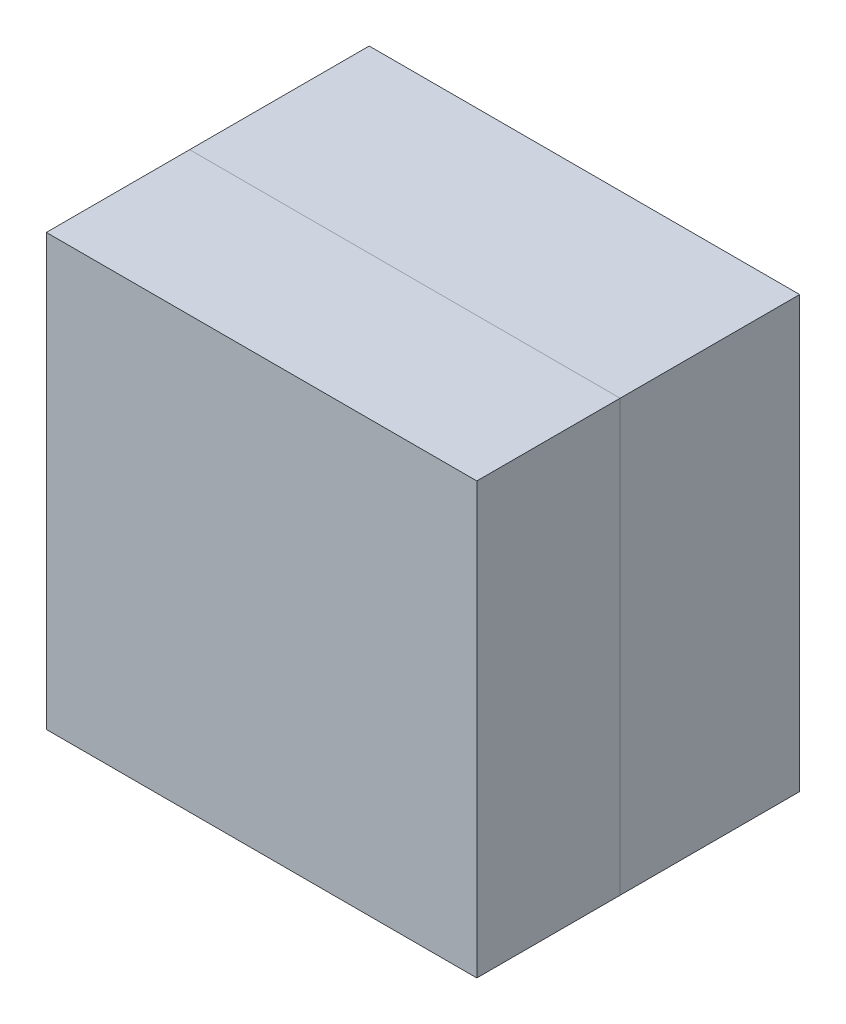
from build123d import *

# Parameters (mm, degrees)
SKETCH1_W           = 304.8
SKETCH1_H           = 304.8
BOSS_EXTRUDE1_DEPTH = 228.6
CAVITY1_OUTLINE_W   = 8.026725253
CAVITY1_OUTLINE_H   = 98.099701296
CAVITY1_OUTLINE_W_2 = 91.798775
CAVITY1_OUTLINE_W_3 = 26.476952247
CAVITY1_OUTLINE_H_2 = 10.562936239
CAVITY1_OUTLINE_H_3 = 12
CAVITY1_OUTLINE_W_4 = 0.3800475
CAVITY1_OUTLINE_W_5 = 11.74498794


# Read off the part's stored shape, not the designer's step: Cavity1
with BuildPart() as part:
    # Sketch1 → Boss-Extrude1 (new body)
    with BuildSketch(Plane.XY):
        Rectangle(SKETCH1_W, SKETCH1_H)
    extrude(amount=BOSS_EXTRUDE1_DEPTH)

    # Cavity1 outline → Cavity1 (revolve, cut)
    with BuildSketch(Plane(origin=(0.908695262, -0.077612753, 0), x_dir=(1, 0, 0), z_dir=(0, -1, 0))):
        Polygon((91.798775, 125.348106713), (91.798775, 127.13294337), (91.186, 127.13294337), (0, 127.13294337), (0, 125.348106713), align=None)
        with BuildLine():
            add(Edge.make_bspline(
                [(91.798775, 127.13294337), (94.605850649, 127.13294337), (97.322433085, 126.518818237), (99.825500253, 125.348106713)],
                knots=[0, 0, 0, 0, 1, 1, 1, 1], degree=3, weights=[0.254333095, 0.254333095, 0.258499794, 0.266833191]))
            Line((91.798775, 127.13294337), (91.798775, 125.348106713))
            Line((91.798775, 125.348106713), (99.825500253, 125.348106713))
        make_face()
        with Locations((95.812137627, 76.298256065)):
            Rectangle(CAVITY1_OUTLINE_W, CAVITY1_OUTLINE_H)
        with BuildLine():
            Line((119.056955539, 116.353347558), (99.825500253, 125.348106713))
            Line((99.825500253, 125.348106713), (99.825500253, 27.248405417))
            Line((99.825500253, 27.248405417), (126.3024525, 27.248405417))
            Line((126.3024525, 27.248405417), (126.3024525, 40.002766714))
            ThreePointArc((126.3024525, 40.002766714), (126.296002424, 40.674677198), (126.276654574, 41.346340032))
            Line((126.276654574, 41.346340032), (123.66176318, 109.413887071))
            ThreePointArc((123.66176318, 109.413887071), (122.333578486, 113.530078475), (119.056955539, 116.353347558))
        make_face()
        with BuildLine():
            Line((0, 127.13294337), (91.186, 127.13294337))
            ThreePointArc((91.186, 127.13294337), (91.49261635, 127.138867697), (91.798775, 127.156631833))
            Line((91.798775, 127.156631833), (91.798775, 224.450968055))
            Line((91.798775, 224.450968055), (0, 224.450968055))
            Line((0, 224.450968055), (0, 127.13294337))
        make_face()
        with Locations((45.8993875, 76.298256065)):
            Rectangle(CAVITY1_OUTLINE_W_2, CAVITY1_OUTLINE_H)
        with BuildLine():
            Line((91.798775, 224.450968055), (91.798775, 127.156631833))
            ThreePointArc((91.798775, 127.156631833), (95.19333333, 128.21878767), (97.783218052, 130.65675781))
            Line((97.783218052, 130.65675781), (99.825500253, 133.709395072))
            Line((99.825500253, 133.709395072), (99.825500253, 224.450968055))
            Line((99.825500253, 224.450968055), (91.798775, 224.450968055))
        make_face()
        with Locations((113.063976376, 21.966937298)):
            Rectangle(CAVITY1_OUTLINE_W_3, CAVITY1_OUTLINE_H_2)
        with Locations((95.812137627, 21.966937298)):
            Rectangle(CAVITY1_OUTLINE_W, CAVITY1_OUTLINE_H_2)
        with BuildLine():
            Line((99.825500253, 224.450968055), (99.825500253, 133.709395072))
            Line((99.825500253, 133.709395072), (122.246455667, 167.222414925))
            ThreePointArc((122.246455667, 167.222414925), (124.382440282, 171.490193303), (125.39064134, 176.15494337))
            Line((125.39064134, 176.15494337), (126.3024525, 186.576992614))
            Line((126.3024525, 186.576992614), (126.3024525, 224.450968055))
            Line((126.3024525, 224.450968055), (99.825500253, 224.450968055))
        make_face()
        with Locations((45.8993875, 21.966937298)):
            Rectangle(CAVITY1_OUTLINE_W_2, CAVITY1_OUTLINE_H_2)
        with Locations((113.063976376, 10.685469178)):
            Rectangle(CAVITY1_OUTLINE_W_3, CAVITY1_OUTLINE_H_3)
        with Locations((95.812137627, 10.685469178)):
            Rectangle(CAVITY1_OUTLINE_W, CAVITY1_OUTLINE_H_3)
        with BuildLine():
            add(Edge.make_bspline(
                [(126.6825, 25.081421339), (126.418277303, 25.811394544), (126.3024525, 26.54497243), (126.3024525, 27.248405417)],
                knots=[0.72047601, 0.72047601, 0.72047601, 0.72047601, 1, 1, 1, 1], degree=3, weights=[0.379245784, 0.4147972, 0.457937335, 0.50866619]))
            Line((126.3024525, 27.248405417), (126.3024525, 16.685469178))
            Line((126.3024525, 16.685469178), (126.6825, 16.685469178))
            Line((126.6825, 16.685469178), (126.6825, 25.081421339))
        make_face()
        with BuildLine():
            Line((126.3024525, 224.450968055), (126.3024525, 186.576992614))
            Line((126.3024525, 186.576992614), (126.585845332, 189.816187504))
            ThreePointArc((126.585845332, 189.816187504), (126.658324828, 190.922010931), (126.6825, 192.02994337))
            Line((126.6825, 192.02994337), (126.6825, 201.586773144))
            Line((126.6825, 201.586773144), (126.6825, 224.450968055))
            Line((126.6825, 224.450968055), (126.3024525, 224.450968055))
        make_face()
        with Locations((45.8993875, 10.685469178)):
            Rectangle(CAVITY1_OUTLINE_W_2, CAVITY1_OUTLINE_H_3)
        with Locations((126.49247625, 10.685469178)):
            Rectangle(CAVITY1_OUTLINE_W_4, CAVITY1_OUTLINE_H_3)
        with BuildLine():
            add(Edge.make_bspline(
                [(133.5197355, 20.96094337), (130.193166053, 20.489176086), (127.664699974, 22.367878288), (126.6825, 25.081421339)],
                knots=[0, 0, 0, 0, 0.72047601, 0.72047601, 0.72047601, 0.72047601], degree=3, weights=[0.255591692, 0.246393608, 0.287611638, 0.379245784]))
            Line((126.6825, 25.081421339), (126.6825, 16.685469178))
            Line((126.6825, 16.685469178), (138.42748794, 16.685469178))
            add(Edge.make_bspline(
                [(133.5197355, 20.96094337), (136.705561076, 21.412750646), (138.42748794, 19.080591171), (138.42748794, 16.685469178)],
                knots=[0, 0, 0, 0, 1, 1, 1, 1], degree=3, weights=[0.255591692, 0.242825015, 0.327183181, 0.50866619]))
        make_face()
        with Locations((132.55499397, 10.685469178)):
            Rectangle(CAVITY1_OUTLINE_W_5, CAVITY1_OUTLINE_H_3)
        with BuildLine():
            Line((138.42748794, 224.450968055), (126.6825, 224.450968055))
            Line((126.6825, 224.450968055), (126.6825, 201.586773144))
            ThreePointArc((126.6825, 201.586773144), (128.772790503, 206.296059184), (133.6675, 207.90494337))
            ThreePointArc((133.6675, 207.90494337), (136.674112341, 208.695362244), (138.42748794, 211.262491725))
            Line((138.42748794, 211.262491725), (138.42748794, 224.450968055))
        make_face()
        with BuildLine():
            Line((138.42748794, 224.450968055), (138.42748794, 211.262491725))
            ThreePointArc((138.42748794, 211.262491725), (138.5166365, 211.729998491), (138.555289406, 212.204357))
            Line((138.555289406, 212.204357), (138.555289406, 212.450968055))
            Line((138.555289406, 212.450968055), (138.555289406, 224.450968055))
            Line((138.555289406, 224.450968055), (138.42748794, 224.450968055))
        make_face()
        with BuildLine():
            Line((138.555289406, 212.450968055), (138.555289406, 212.204357))
            ThreePointArc((138.555289406, 212.204357), (138.556572331, 212.266003842), (138.557, 212.327662549))
            ThreePointArc((138.557, 212.327662549), (138.556572331, 212.389321235), (138.555289406, 212.450968055))
        make_face()
    revolve(axis=Axis((0.908695262, -0.077612753, 0), (0, 0, 1)), mode=Mode.SUBTRACT)


with BuildPart() as body_2:
    # Split1: the piece on the far side of the plane
    add(part.part)
    split(bisect_by=Plane(origin=(0, 0, 127.13294337), x_dir=(0, -1, 0), z_dir=(0, 0, -1)), keep=Keep.BOTTOM)


with BuildPart() as part_1:
    add(part.part)

    # Split1
    split(bisect_by=Plane(origin=(0, 0, 127.13294337), x_dir=(0, -1, 0), z_dir=(0, 0, -1)), keep=Keep.TOP)


solid = Compound([body_2.part, part_1.part])
